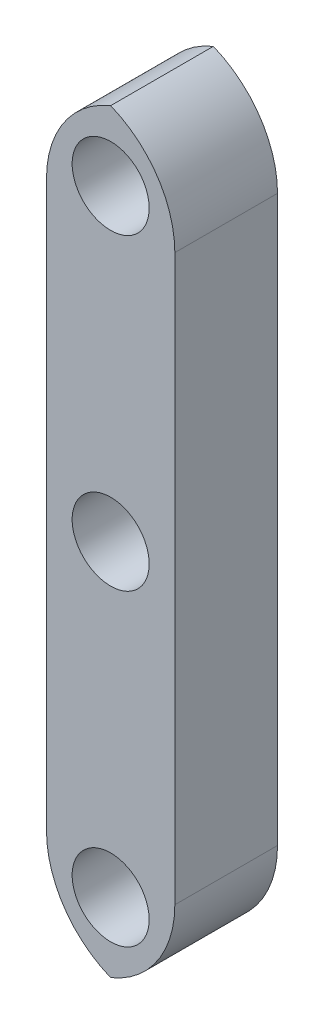
from build123d import *

# Parameters (mm, degrees)
SKETCH3_W           = 38.1
SKETCH3_H           = 6.35
BOSS_EXTRUDE1_DEPTH = 5.08
SKETCH4_R           = 1.905
CUT_EXTRUDE1_DEPTH  = 39.958168591
FILLET2_R           = 5.08


with BuildPart() as part:
    # Sketch3 → Boss-Extrude1 (new body)
    with BuildSketch(Plane(origin=(0, 0, 0), x_dir=(0, 1, 0), z_dir=(0, 0, 1))):
        with Locations((19.05, 3.175)):
            Rectangle(SKETCH3_W, SKETCH3_H)
    extrude(amount=BOSS_EXTRUDE1_DEPTH)

    # Sketch4 → Cut-Extrude1 (cut, through all)
    with BuildSketch(Plane(origin=(0, 0, 5.08), x_dir=(0, -1, 0), z_dir=(0, 0, 1))):
        with Locations(Location((-3.81, -3.175, 0), (0, 0, 90))):
            Circle(SKETCH4_R)
        with Locations(Location((-19.05, -3.175, 0), (0, 0, 90))):
            Circle(SKETCH4_R)
        with Locations(Location((-34.29, -3.175, 0), (0, 0, 90))):
            Circle(SKETCH4_R)
    extrude(amount=-CUT_EXTRUDE1_DEPTH, mode=Mode.SUBTRACT)

    # Fillet2
    # the kernel refuses this fillet: 5.08 mm, written as the material it takes off along each edge
    with BuildSketch(Plane(origin=(0, 38.1, -12.7), x_dir=(0, -1, 0), z_dir=(0, 0, 1)), Plane(origin=(-6.35, 38.1, -12.7), x_dir=(1, 0, 0), z_dir=(0, 0, 1))) as fillet2_piece_1:
        with BuildLine():
            CenterArc((FILLET2_R, -FILLET2_R), FILLET2_R, 90, 90)
            Line((0, -FILLET2_R), (0, 0))
            Line((0, 0), (FILLET2_R, 0))
        make_face()
    extrude(amount=30.48, mode=Mode.SUBTRACT)
    with BuildSketch(Plane(origin=(0, 0, -12.7), x_dir=(0, 1, 0), z_dir=(0, 0, 1)), Plane(origin=(-6.35, 0, -12.7), x_dir=(1, 0, 0), z_dir=(0, 0, 1))) as fillet2_piece_2:
        with BuildLine():
            CenterArc((FILLET2_R, FILLET2_R), FILLET2_R, 180, 90)
            Line((0, FILLET2_R), (0, 0))
            Line((0, 0), (FILLET2_R, 0))
        make_face()
    extrude(amount=30.48, mode=Mode.SUBTRACT)


solid = part.part
